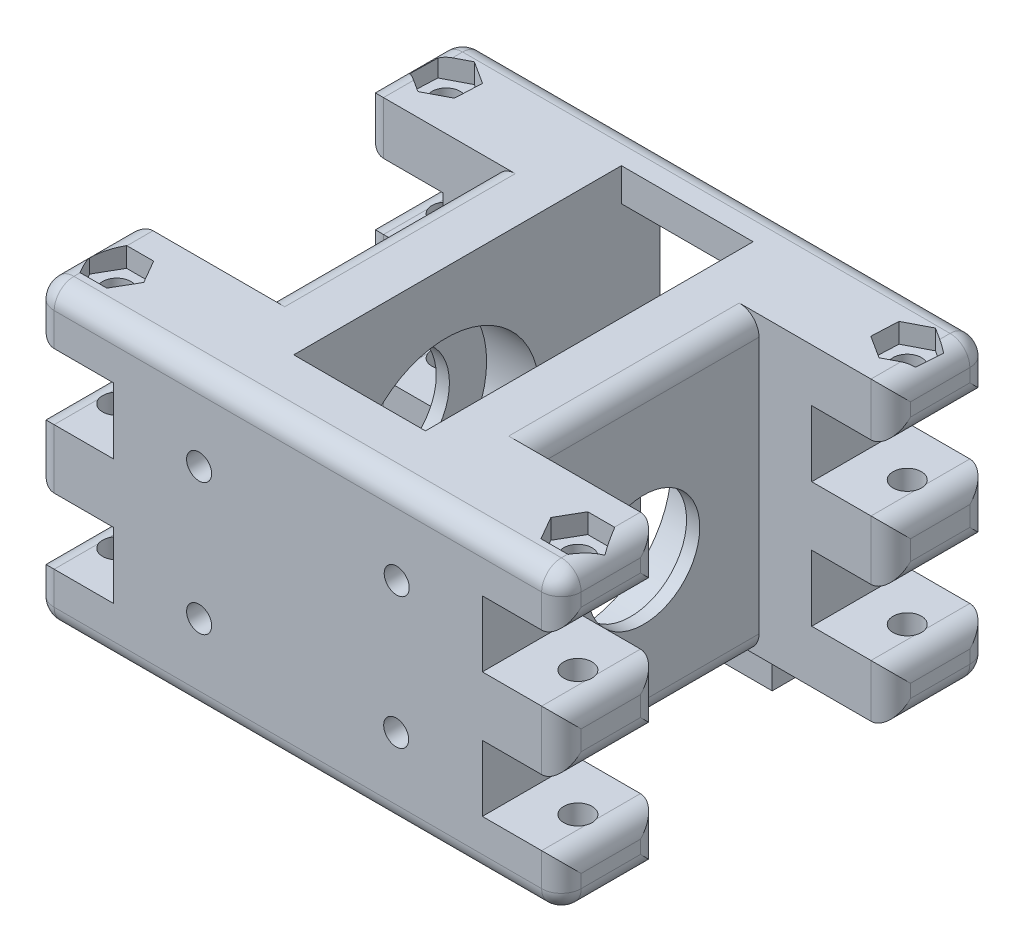
from build123d import *

# Parameters (mm, degrees)
MAIN_BODY_DEPTH            = 45
SKETCH3_W                  = 12
SKETCH3_H                  = 10
SUSPENSION_ARM_HOLE_DEPTH  = 92.869076093
SKETCH6_R                  = 8.5
AXLE_HOLE_DEPTH            = 91.851078857
SKETCH8_R                  = 2.15
SCREW_HOLE_DEPTH           = 83.727538774
SKETCH9_R                  = 4
SCREW_CLEARANCE_HOLE_DEPTH = 3
NUT_INSERT_HOLE_DEPTH      = 3
FILLET2_R                  = 3
FILLET4_R                  = 3
FILLET5_R                  = 3
SKETCH11_R                 = 1.9
MAIN_SCEW_HOLES_DEPTH      = 20
SKETCH5_W                  = 20
SKETCH5_H                  = 40
GEAR_SLOT_DEPTH            = 60
BEARING_HOLE_DEPTH         = 28
BEARING_HOLE_DEPTH_BACK    = 8
SKETCH12_R                 = 14.15
SKETCH13_W                 = 20
SKETCH13_H                 = 39.48022423
CUT_EXTRUDE1_DEPTH         = 81.117699038
SKETCH14_W                 = 20
SKETCH14_H                 = 30.450612157
CUT_EXTRUDE2_DEPTH         = 2
SKETCH15_W                 = 20
SKETCH15_H                 = 4.363509749
CUT_EXTRUDE3_DEPTH         = 10
SKETCH16_W                 = 20
SKETCH16_H                 = 5.896378136
CUT_EXTRUDE4_DEPTH         = 10
SKETCH17_W                 = 8
SKETCH17_H                 = 8
BOSS_EXTRUDE1_DEPTH        = 7.5
SKETCH18_R                 = 1.75
CUT_EXTRUDE5_DEPTH         = 7.5
SKETCH19_R                 = 1.45
CUT_EXTRUDE6_DEPTH         = 10
FILLET6_R                  = 5
FILLET7_R                  = 2


# Some blends are built 0.0001 mm under size
with BuildPart() as part:
    # Sketch2 → Main Body (new body)
    with BuildSketch(Plane(origin=(0, 0, 0), x_dir=(1, 0, 0), z_dir=(0, 1, 0))):
        Polygon((-46.796657382, 36.272980501), (-26.796657382, 36.272980501), (-26.796657382, 1.272980501), (-46.796657382, 1.272980501), (-46.796657382, -13.727019499), (33.203342618, -13.727019499), (33.203342618, 1.272980501), (13.203342618, 1.272980501), (13.203342618, 36.272980501), (33.203342618, 36.272980501), (33.203342618, 51.272980501), (-46.796657382, 51.272980501), align=None)
    extrude(amount=MAIN_BODY_DEPTH)

    # Sketch3 → Suspension Arm Hole (cut, through all)
    with BuildSketch(Plane(origin=(0, 0, -51.272980501), x_dir=(-1, 0, 0), z_dir=(0, 0, -1))):
        with Locations((-27.203342618, 32)):
            Rectangle(SKETCH3_W, SKETCH3_H)
        with Locations((-27.203342618, 13)):
            Rectangle(SKETCH3_W, SKETCH3_H)
        with Locations((40.796657382, 32)):
            Rectangle(SKETCH3_W, SKETCH3_H)
        with Locations((40.796657382, 13)):
            Rectangle(SKETCH3_W, SKETCH3_H)
    extrude(amount=-SUSPENSION_ARM_HOLE_DEPTH, mode=Mode.SUBTRACT)

    # Sketch6 → Axle Hole (cut, through all)
    with BuildSketch(Plane(origin=(13.203342618, 0, 0), x_dir=(0, 0, -1), z_dir=(1, 0, 0))):
        with Locations((18.772980501, 21.5)):
            Circle(SKETCH6_R)
    extrude(amount=-AXLE_HOLE_DEPTH, mode=Mode.SUBTRACT)

    # Sketch8 → Screw Hole (cut, through all)
    with BuildSketch(Plane.XZ):
        with Locations(Location((-41.796657382, 6.227019499, 0), (0, 0, 270))):
            Circle(SKETCH8_R)
        with Locations(Location((28.203342618, 6.227019499, 0), (0, 0, 270))):
            Circle(SKETCH8_R)
        with Locations(Location((-41.796657382, -43.772980501, 0), (0, 0, 270))):
            Circle(SKETCH8_R)
        with Locations(Location((28.203342618, -43.772980501, 0), (0, 0, 270))):
            Circle(SKETCH8_R)
    extrude(amount=-SCREW_HOLE_DEPTH, mode=Mode.SUBTRACT)

    # Sketch9 → Screw Clearance Hole (cut)
    with BuildSketch(Plane.XZ):
        with Locations(Location((-41.796657382, 6.227019499, 0), (0, 0, 270))):
            Circle(SKETCH9_R)
        with Locations(Location((28.203342618, 6.227019499, 0), (0, 0, 270))):
            Circle(SKETCH9_R)
        with Locations(Location((28.203342618, -43.772980501, 0), (0, 0, 270))):
            Circle(SKETCH9_R)
        with Locations(Location((-41.796657382, -43.772980501, 0), (0, 0, 270))):
            Circle(SKETCH9_R)
    extrude(amount=-SCREW_CLEARANCE_HOLE_DEPTH, mode=Mode.SUBTRACT)

    # Sketch10 → Nut Insert Hole (cut)
    with BuildSketch(Plane(origin=(0, 45, 0), x_dir=(1, 0, 0), z_dir=(0, 1, 0))):
        Polygon((28.387835771, 47.868827456), (24.748481682, 45.980679735), (24.563988529, 41.884832781), (28.018849466, 39.677133547), (31.658203555, 41.565281267), (31.842696707, 45.661128222), align=None)
        Polygon((-41.612164229, 47.868827456), (-45.251518318, 45.980679735), (-45.436011471, 41.884832781), (-41.981150534, 39.677133547), (-38.341796445, 41.565281267), (-38.157303293, 45.661128222), align=None)
        Polygon((-45.896657382, -6.227019499), (-43.846657382, -9.777723654), (-39.746657382, -9.777723654), (-37.696657382, -6.227019499), (-39.746657382, -2.676315343), (-43.846657382, -2.676315343), align=None)
        Polygon((24.103342618, -6.227019499), (26.153342618, -9.777723654), (30.253342618, -9.777723654), (32.303342618, -6.227019499), (30.253342618, -2.676315343), (26.153342618, -2.676315343), align=None)
    extrude(amount=-NUT_INSERT_HOLE_DEPTH, mode=Mode.SUBTRACT)

    # Fillet2
    # the kernel refuses this fillet: 3 mm, written as the material it takes off along each edge
    with BuildSketch(Plane(origin=(33.203342618, 45, 21.227019499), x_dir=(-1, 0, 0), z_dir=(0, 0, -1)), Plane(origin=(33.203342618, 27, -8.772980501), x_dir=(0, -1, 0), z_dir=(0, 0, 1)), Plane(origin=(33.203342618, 18, -8.772980501), x_dir=(-1, 0, 0), z_dir=(0, 0, 1)), Plane(origin=(33.203342618, 8, -8.772980501), x_dir=(0, -1, 0), z_dir=(0, 0, 1)), Plane(origin=(33.203342618, 8, -58.772980501), x_dir=(0, -1, 0), z_dir=(0, 0, 1)), Plane(origin=(33.203342618, 45, -28.772980501), x_dir=(-1, 0, 0), z_dir=(0, 0, -1)), Plane(origin=(-46.796657382, 45, -8.772980501), x_dir=(1, 0, 0), z_dir=(0, 0, 1)), Plane(origin=(-46.796657382, 37, -8.772980501), x_dir=(0, 1, 0), z_dir=(0, 0, 1)), Plane(origin=(-46.796657382, 45, -58.772980501), x_dir=(1, 0, 0), z_dir=(0, 0, 1)), Plane(origin=(-46.796657382, 37, -58.772980501), x_dir=(0, 1, 0), z_dir=(0, 0, 1)), Plane(origin=(-46.796657382, 18, -58.772980501), x_dir=(0, 1, 0), z_dir=(0, 0, 1)), Plane(origin=(-46.796657382, 27, -58.772980501), x_dir=(1, 0, 0), z_dir=(0, 0, 1)), Plane(origin=(-46.796657382, 8, -58.772980501), x_dir=(1, 0, 0), z_dir=(0, 0, 1))) as fillet2_piece_1:
        with BuildLine():
            CenterArc((FILLET2_R, -FILLET2_R), FILLET2_R, 90, 90)
            Line((0, -FILLET2_R), (0, 0))
            Line((0, 0), (FILLET2_R, 0))
        make_face()
    extrude(amount=30, mode=Mode.SUBTRACT)
    with BuildSketch(Plane(origin=(33.203342618, 29.5, -1.272980501), x_dir=(-1, 0, 0), z_dir=(0, 1, 0)), Plane(origin=(33.203342618, -7.5, -36.272980501), x_dir=(0, 0, -1), z_dir=(0, 1, 0)), Plane(origin=(33.203342618, -7.5, -51.272980501), x_dir=(-1, 0, 0), z_dir=(0, 1, 0)), Plane(origin=(33.203342618, 29.5, -51.272980501), x_dir=(-1, 0, 0), z_dir=(0, 1, 0)), Plane(origin=(-46.796657382, 29.5, 13.727019499), x_dir=(1, 0, 0), z_dir=(0, 1, 0)), Plane(origin=(-46.796657382, 29.5, -36.272980501), x_dir=(1, 0, 0), z_dir=(0, 1, 0)), Plane(origin=(-46.796657382, 29.5, -51.272980501), x_dir=(0, 0, 1), z_dir=(0, 1, 0)), Plane(origin=(-46.796657382, -7.5, -51.272980501), x_dir=(0, 0, 1), z_dir=(0, 1, 0)), Plane(origin=(-46.796657382, -7.5, -36.272980501), x_dir=(1, 0, 0), z_dir=(0, 1, 0))) as fillet2_piece_2:
        with BuildLine():
            CenterArc((FILLET2_R, FILLET2_R), FILLET2_R, 180, 90)
            Line((0, FILLET2_R), (0, 0))
            Line((0, 0), (FILLET2_R, 0))
        make_face()
    extrude(amount=23, mode=Mode.SUBTRACT)
    with BuildSketch(Plane(origin=(33.203342618, 37, -8.772980501), x_dir=(0, 1, 0), z_dir=(0, 0, 1)), Plane(origin=(33.203342618, 0, 21.227019499), x_dir=(-1, 0, 0), z_dir=(0, 0, -1)), Plane(origin=(33.203342618, 0, -28.772980501), x_dir=(-1, 0, 0), z_dir=(0, 0, -1)), Plane(origin=(33.203342618, 27, -58.772980501), x_dir=(-1, 0, 0), z_dir=(0, 0, 1)), Plane(origin=(33.203342618, 18, -58.772980501), x_dir=(0, 1, 0), z_dir=(0, 0, 1)), Plane(origin=(33.203342618, 37, -58.772980501), x_dir=(0, 1, 0), z_dir=(0, 0, 1)), Plane(origin=(-46.796657382, 18, -8.772980501), x_dir=(1, 0, 0), z_dir=(0, 0, 1)), Plane(origin=(-46.796657382, 27, -8.772980501), x_dir=(0, -1, 0), z_dir=(0, 0, 1)), Plane(origin=(-46.796657382, 0, -8.772980501), x_dir=(1, 0, 0), z_dir=(0, 0, 1)), Plane(origin=(-46.796657382, 8, -8.772980501), x_dir=(0, -1, 0), z_dir=(0, 0, 1)), Plane(origin=(-46.796657382, 0, -58.772980501), x_dir=(1, 0, 0), z_dir=(0, 0, 1))) as fillet2_piece_3:
        with BuildLine():
            CenterArc((FILLET2_R, FILLET2_R), FILLET2_R, 180, 90)
            Line((0, FILLET2_R), (0, 0))
            Line((0, 0), (FILLET2_R, 0))
        make_face()
    extrude(amount=30, mode=Mode.SUBTRACT)
    with BuildSketch(Plane(origin=(33.203342618, 29.5, 13.727019499), x_dir=(-1, 0, 0), z_dir=(0, 1, 0)), Plane(origin=(33.203342618, -7.5, 13.727019499), x_dir=(-1, 0, 0), z_dir=(0, 1, 0)), Plane(origin=(33.203342618, -7.5, -1.272980501), x_dir=(0, 0, 1), z_dir=(0, 1, 0)), Plane(origin=(33.203342618, 29.5, -36.272980501), x_dir=(-1, 0, 0), z_dir=(0, 1, 0)), Plane(origin=(-46.796657382, 29.5, -1.272980501), x_dir=(1, 0, 0), z_dir=(0, 1, 0)), Plane(origin=(-46.796657382, -7.5, -1.272980501), x_dir=(1, 0, 0), z_dir=(0, 1, 0)), Plane(origin=(-46.796657382, -7.5, 13.727019499), x_dir=(0, 0, -1), z_dir=(0, 1, 0))) as fillet2_piece_4:
        with BuildLine():
            CenterArc((FILLET2_R, -FILLET2_R), FILLET2_R, 90, 90)
            Line((0, -FILLET2_R), (0, 0))
            Line((0, 0), (FILLET2_R, 0))
        make_face()
    extrude(amount=23, mode=Mode.SUBTRACT)
    with BuildSketch(Plane(origin=(33.203342618, 10.5, -1.272980501), x_dir=(-1, 0, 0), z_dir=(0, 1, 0)), Plane(origin=(33.203342618, 10.5, -51.272980501), x_dir=(-1, 0, 0), z_dir=(0, 1, 0)), Plane(origin=(-46.796657382, 10.5, 13.727019499), x_dir=(1, 0, 0), z_dir=(0, 1, 0)), Plane(origin=(-46.796657382, 10.5, -51.272980501), x_dir=(0, 0, 1), z_dir=(0, 1, 0)), Plane(origin=(-46.796657382, 10.5, -36.272980501), x_dir=(1, 0, 0), z_dir=(0, 1, 0))) as fillet2_piece_5:
        with BuildLine():
            CenterArc((FILLET2_R, FILLET2_R), FILLET2_R, 180, 90)
            Line((0, FILLET2_R), (0, 0))
            Line((0, 0), (FILLET2_R, 0))
        make_face()
    extrude(amount=24, mode=Mode.SUBTRACT)
    with BuildSketch(Plane(origin=(33.203342618, 10.5, 13.727019499), x_dir=(-1, 0, 0), z_dir=(0, 1, 0)), Plane(origin=(33.203342618, 10.5, -36.272980501), x_dir=(-1, 0, 0), z_dir=(0, 1, 0)), Plane(origin=(-46.796657382, 10.5, -1.272980501), x_dir=(1, 0, 0), z_dir=(0, 1, 0))) as fillet2_piece_6:
        with BuildLine():
            CenterArc((FILLET2_R, -FILLET2_R), FILLET2_R, 90, 90)
            Line((0, -FILLET2_R), (0, 0))
            Line((0, 0), (FILLET2_R, 0))
        make_face()
    extrude(amount=24, mode=Mode.SUBTRACT)

    # Fillet4
    # the kernel refuses this fillet: 3 mm, written as the material it takes off along each edge
    with BuildSketch(Plane(origin=(30.203342618, 42, 10.727019499), x_dir=(0, 0, 1), z_dir=(0, 1, 0))) as fillet4_piece_1_section:
        Polygon((0, 0), (FILLET4_R, 0), (FILLET4_R, FILLET4_R), (0, FILLET4_R), align=None)
    fillet4_piece_1 = extrude(amount=FILLET4_R, mode=Mode.PRIVATE)
    fillet4_piece_1 = fillet4_piece_1 - Plane(origin=(30.203342618, 42, 10.727019499), x_dir=(-0.7071067811865477, 0, -0.7071067811865475), z_dir=(0, 1, 0)) * Sphere(FILLET4_R, mode=Mode.PRIVATE)
    add(fillet4_piece_1, mode=Mode.SUBTRACT)
    with BuildSketch(Plane(origin=(30.203342618, 42, -48.272980501), x_dir=(0, 0, -1), z_dir=(0, 1, 0))) as fillet4_piece_2_section:
        Polygon((0, 0), (FILLET4_R, 0), (FILLET4_R, -FILLET4_R), (0, -FILLET4_R), align=None)
    fillet4_piece_2 = extrude(amount=FILLET4_R, mode=Mode.PRIVATE)
    fillet4_piece_2 = fillet4_piece_2 - Plane(origin=(30.203342618, 42, -48.272980501), x_dir=(-0.7071067811865475, 0, 0.7071067811865476), z_dir=(0, 1, 0)) * Sphere(FILLET4_R, mode=Mode.PRIVATE)
    add(fillet4_piece_2, mode=Mode.SUBTRACT)
    with BuildSketch(Plane(origin=(-43.796657382, 42, 10.727019499), x_dir=(0, 0, 1), z_dir=(0, 1, 0))) as fillet4_piece_3_section:
        Polygon((0, 0), (FILLET4_R, 0), (FILLET4_R, -FILLET4_R), (0, -FILLET4_R), align=None)
    fillet4_piece_3 = extrude(amount=FILLET4_R, mode=Mode.PRIVATE)
    fillet4_piece_3 = fillet4_piece_3 - Plane(origin=(-43.796657382, 42, 10.727019499), x_dir=(0.7071067811865475, 0, -0.7071067811865476), z_dir=(0, 1, 0)) * Sphere(FILLET4_R, mode=Mode.PRIVATE)
    add(fillet4_piece_3, mode=Mode.SUBTRACT)
    with BuildSketch(Plane(origin=(-43.796657382, 42, -48.272980501), x_dir=(0, 0, -1), z_dir=(0, 1, 0))) as fillet4_piece_4_section:
        Polygon((0, 0), (FILLET4_R, 0), (FILLET4_R, FILLET4_R), (0, FILLET4_R), align=None)
    fillet4_piece_4 = extrude(amount=FILLET4_R, mode=Mode.PRIVATE)
    fillet4_piece_4 = fillet4_piece_4 - Plane(origin=(-43.796657382, 42, -48.272980501), x_dir=(0.7071067811865477, 0, 0.7071067811865475), z_dir=(0, 1, 0)) * Sphere(FILLET4_R, mode=Mode.PRIVATE)
    add(fillet4_piece_4, mode=Mode.SUBTRACT)
    with BuildSketch(Plane(origin=(13.203342618, 45, -1.272980501), x_dir=(-1, 0, 0), z_dir=(0, 0, -1))) as fillet4_piece_5:
        with BuildLine():
            CenterArc((FILLET4_R, -FILLET4_R), FILLET4_R, 90, 90)
            Line((0, -FILLET4_R), (0, 0))
            Line((0, 0), (FILLET4_R, 0))
        make_face()
    extrude(amount=35, mode=Mode.SUBTRACT)
    with BuildSketch(Plane(origin=(30.203342618, 45, -51.272980501), x_dir=(0, 0, 1), z_dir=(-1, 0, 0)), Plane(origin=(-43.796657382, 45, 13.727019499), x_dir=(0, 0, -1), z_dir=(1, 0, 0))) as fillet4_piece_6:
        with BuildLine():
            CenterArc((FILLET4_R, -FILLET4_R), FILLET4_R, 90, 90)
            Line((0, -FILLET4_R), (0, 0))
            Line((0, 0), (FILLET4_R, 0))
        make_face()
    extrude(amount=74, mode=Mode.SUBTRACT)
    with BuildSketch(Plane(origin=(-26.796657382, 45, -36.272980501), x_dir=(0, -1, 0), z_dir=(0, 0, 1))) as fillet4_piece_7:
        with BuildLine():
            CenterArc((FILLET4_R, FILLET4_R), FILLET4_R, 180, 90)
            Line((0, FILLET4_R), (0, 0))
            Line((0, 0), (FILLET4_R, 0))
        make_face()
    extrude(amount=35, mode=Mode.SUBTRACT)

    # Fillet5
    # the kernel refuses this fillet: 3 mm, written as the material it takes off along each edge
    with BuildSketch(Plane(origin=(30.203342618, 3, 10.727019499), x_dir=(0, -1, 0), z_dir=(0, 0, 1))) as fillet5_piece_1_section:
        Polygon((0, 0), (FILLET5_R, 0), (FILLET5_R, FILLET5_R), (0, FILLET5_R), align=None)
    fillet5_piece_1 = extrude(amount=FILLET5_R, mode=Mode.PRIVATE)
    fillet5_piece_1 = fillet5_piece_1 - Plane(origin=(30.203342618, 3, 10.727019499), x_dir=(-0.7071067811865475, 0.7071067811865475, 0), z_dir=(0, 0, 1)) * Sphere(FILLET5_R, mode=Mode.PRIVATE)
    add(fillet5_piece_1, mode=Mode.SUBTRACT)
    with BuildSketch(Plane(origin=(30.203342618, 3, -48.272980501), x_dir=(0, -1, 0), z_dir=(0, 0, -1))) as fillet5_piece_2_section:
        Polygon((0, 0), (FILLET5_R, 0), (FILLET5_R, -FILLET5_R), (0, -FILLET5_R), align=None)
    fillet5_piece_2 = extrude(amount=FILLET5_R, mode=Mode.PRIVATE)
    fillet5_piece_2 = fillet5_piece_2 - Plane(origin=(30.203342618, 3, -48.272980501), x_dir=(-0.7071067811865475, 0.7071067811865475, 0), z_dir=(0, 0, -1)) * Sphere(FILLET5_R, mode=Mode.PRIVATE)
    add(fillet5_piece_2, mode=Mode.SUBTRACT)
    with BuildSketch(Plane(origin=(-43.796657382, 3, 10.727019499), x_dir=(0, -1, 0), z_dir=(0, 0, 1))) as fillet5_piece_3_section:
        Polygon((0, 0), (FILLET5_R, 0), (FILLET5_R, -FILLET5_R), (0, -FILLET5_R), align=None)
    fillet5_piece_3 = extrude(amount=FILLET5_R, mode=Mode.PRIVATE)
    fillet5_piece_3 = fillet5_piece_3 - Plane(origin=(-43.796657382, 3, 10.727019499), x_dir=(0.7071067811865475, 0.7071067811865475, 0), z_dir=(0, 0, 1)) * Sphere(FILLET5_R, mode=Mode.PRIVATE)
    add(fillet5_piece_3, mode=Mode.SUBTRACT)
    with BuildSketch(Plane(origin=(-43.796657382, 3, -48.272980501), x_dir=(0, -1, 0), z_dir=(0, 0, -1))) as fillet5_piece_4_section:
        Polygon((0, 0), (FILLET5_R, 0), (FILLET5_R, FILLET5_R), (0, FILLET5_R), align=None)
    fillet5_piece_4 = extrude(amount=FILLET5_R, mode=Mode.PRIVATE)
    fillet5_piece_4 = fillet5_piece_4 - Plane(origin=(-43.796657382, 3, -48.272980501), x_dir=(0.7071067811865475, 0.7071067811865475, 0), z_dir=(0, 0, -1)) * Sphere(FILLET5_R, mode=Mode.PRIVATE)
    add(fillet5_piece_4, mode=Mode.SUBTRACT)
    with BuildSketch(Plane(origin=(-26.796657382, 0, -36.272980501), x_dir=(0, 1, 0), z_dir=(0, 0, 1)), Plane(origin=(13.203342618, 0, -1.272980501), x_dir=(0, 1, 0), z_dir=(0, 0, -1))) as fillet5_piece_5:
        with BuildLine():
            CenterArc((FILLET5_R, -FILLET5_R), FILLET5_R, 90, 90)
            Line((0, -FILLET5_R), (0, 0))
            Line((0, 0), (FILLET5_R, 0))
        make_face()
    extrude(amount=35, mode=Mode.SUBTRACT)
    with BuildSketch(Plane(origin=(-43.796657382, 0, 13.727019499), x_dir=(0, 1, 0), z_dir=(1, 0, 0)), Plane(origin=(30.203342618, 0, -51.272980501), x_dir=(0, 1, 0), z_dir=(-1, 0, 0))) as fillet5_piece_6:
        with BuildLine():
            CenterArc((FILLET5_R, -FILLET5_R), FILLET5_R, 90, 90)
            Line((0, -FILLET5_R), (0, 0))
            Line((0, 0), (FILLET5_R, 0))
        make_face()
    extrude(amount=74, mode=Mode.SUBTRACT)

    # Sketch11 → Main Scew Holes (cut)
    with BuildSketch(Plane.XY.offset(13.727019499)):
        with Locations((-21.796657382, 32.5)):
            Circle(SKETCH11_R)
        with Locations((8.203342618, 32.5)):
            Circle(SKETCH11_R)
        with Locations((-21.796657382, 12.5)):
            Circle(SKETCH11_R)
        with Locations((8.123310636, 12.5)):
            Circle(SKETCH11_R)
    extrude(amount=-MAIN_SCEW_HOLES_DEPTH, mode=Mode.SUBTRACT)

    # Sketch5 → Gear Slot (cut)
    with BuildSketch(Plane(origin=(0, 0, -51.272980501), x_dir=(-1, 0, 0), z_dir=(0, 0, -1))):
        with Locations((6.796657382, 20)):
            Rectangle(SKETCH5_W, SKETCH5_H)
    extrude(amount=-GEAR_SLOT_DEPTH, mode=Mode.SUBTRACT)

    # Sketch12 → Bearing Hole (cut, two sides: drawn at the far end of the back side and taken through both)
    with BuildSketch(Plane(origin=(-16.796657382, 0, 0), x_dir=(0, 0, -1), z_dir=(1, 0, 0)).offset(-BEARING_HOLE_DEPTH_BACK)):
        with Locations(Location((18.772980501, 21.5, 0), (0, 0, 270))):
            Circle(SKETCH12_R)
    extrude(amount=BEARING_HOLE_DEPTH + BEARING_HOLE_DEPTH_BACK, mode=Mode.SUBTRACT)

    # Sketch13 → Cut-Extrude1 (cut, through all)
    with BuildSketch(Plane.XZ.offset(-40)):
        with Locations((-6.796657382, -19.740112115)):
            Rectangle(SKETCH13_W, SKETCH13_H)
    extrude(amount=-CUT_EXTRUDE1_DEPTH, mode=Mode.SUBTRACT)

    # Sketch14 → Cut-Extrude2 (cut)
    with BuildSketch(Plane(origin=(0, 0, 8.727019499), x_dir=(-1, 0, 0), z_dir=(0, 0, -1))):
        with Locations((6.796657382, 19.272897082)):
            Rectangle(SKETCH14_W, SKETCH14_H)
    extrude(amount=-CUT_EXTRUDE2_DEPTH, mode=Mode.SUBTRACT)

    # Sketch15 → Cut-Extrude3 (cut)
    with BuildSketch(Plane.XZ.offset(-40)):
        with Locations((-6.796657382, 2.181754875)):
            Rectangle(SKETCH15_W, SKETCH15_H)
    extrude(amount=-CUT_EXTRUDE3_DEPTH, mode=Mode.SUBTRACT)

    # Sketch16 → Cut-Extrude4 (cut)
    with BuildSketch(Plane.XZ.offset(-40)):
        with Locations((-6.796657382, -42.428413298)):
            Rectangle(SKETCH16_W, SKETCH16_H)
    extrude(amount=-CUT_EXTRUDE4_DEPTH, mode=Mode.SUBTRACT)

    # Sketch17 → Boss-Extrude1 (add)
    with BuildSketch(Plane.XZ):
        with Locations((-20.796657382, -44.272980501)):
            Rectangle(SKETCH17_W, SKETCH17_H)
        with Locations((7.203342618, -44.272980501)):
            Rectangle(SKETCH17_W, SKETCH17_H)
    extrude(amount=BOSS_EXTRUDE1_DEPTH)

    # Sketch18 → Cut-Extrude5 (cut)
    with BuildSketch(Plane.XZ.offset(7.5)):
        with Locations(Location((-20.796657382, -44.472980501, 0), (0, 0, 270))):
            Circle(SKETCH18_R)
        with Locations(Location((7.203342618, -44.472980501, 0), (0, 0, 270))):
            Circle(SKETCH18_R)
    extrude(amount=-CUT_EXTRUDE5_DEPTH, mode=Mode.SUBTRACT)

    # Sketch19 → Cut-Extrude6 (cut)
    with BuildSketch(Plane(origin=(0, 0, -51.272980501), x_dir=(-1, 0, 0), z_dir=(0, 0, -1))):
        with Locations((-9.203342618, 35)):
            Circle(SKETCH19_R)
        with Locations((22.796657382, 35)):
            Circle(SKETCH19_R)
        with Locations((-9.203342618, 10)):
            Circle(SKETCH19_R)
        with Locations((22.796657382, 10)):
            Circle(SKETCH19_R)
    extrude(amount=-CUT_EXTRUDE6_DEPTH, mode=Mode.SUBTRACT)

    # Fillet6
    # the kernel refuses this fillet: 5 mm, written as the material it takes off along each edge
    with BuildSketch(Plane(origin=(3.203342618, 0, -40.272980501), x_dir=(1, 0, 0), z_dir=(0, 0, 1))) as fillet6_piece_1:
        with BuildLine():
            CenterArc((FILLET6_R, FILLET6_R), FILLET6_R, 180, 90)
            Line((0, FILLET6_R), (0, 0))
            Line((0, 0), (FILLET6_R, 0))
        make_face()
    extrude(amount=49, mode=Mode.SUBTRACT)
    with BuildSketch(Plane(origin=(3.203342618, 0, -40.272980501), x_dir=(1, 0, 0), z_dir=(0, 0, 1))) as fillet6_piece_2_section:
        with BuildLine():
            CenterArc((FILLET6_R, FILLET6_R), FILLET6_R, 180, 90)
            Line((0, FILLET6_R), (0, 0))
            Line((0, 0), (FILLET6_R, 0))
        make_face()
    fillet6_piece_2 = extrude(amount=61.5, mode=Mode.PRIVATE)
    fillet6_piece_2 = split(fillet6_piece_2, bisect_by=Plane(origin=(3.230762882, 4.285255133, 10.727019499), z_dir=(0, 0, -1)), keep=Keep.TOP, mode=Mode.PRIVATE)
    fillet6_piece_2 = split(fillet6_piece_2, bisect_by=Plane(origin=(3.230762882, 4.047591003, 9.727019499), z_dir=(0, 1, 0)), keep=Keep.TOP, mode=Mode.PRIVATE)
    add(fillet6_piece_2, mode=Mode.SUBTRACT)
    with BuildSketch(Plane(origin=(-16.796657382, 0, -40.272980501), x_dir=(-1, 0, 0), z_dir=(0, 0, 1))) as fillet6_piece_3:
        with BuildLine():
            CenterArc((FILLET6_R, -FILLET6_R), FILLET6_R, 90, 90)
            Line((0, -FILLET6_R), (0, 0))
            Line((0, 0), (FILLET6_R, 0))
        make_face()
    extrude(amount=49, mode=Mode.SUBTRACT)
    with BuildSketch(Plane(origin=(-16.796657382, 0, -52.772980501), x_dir=(-1, 0, 0), z_dir=(0, 0, 1))) as fillet6_piece_4_section:
        with BuildLine():
            CenterArc((FILLET6_R, -FILLET6_R), FILLET6_R, 90, 90)
            Line((0, -FILLET6_R), (0, 0))
            Line((0, 0), (FILLET6_R, 0))
        make_face()
    fillet6_piece_4 = extrude(amount=74, mode=Mode.PRIVATE)
    fillet6_piece_4 = split(fillet6_piece_4, bisect_by=Plane(origin=(-16.824077645, 4.285255133, 8.727019499), z_dir=(0, 0, 1)), keep=Keep.TOP, mode=Mode.PRIVATE)
    fillet6_piece_4 = split(fillet6_piece_4, bisect_by=Plane(origin=(-16.824077645, 4.285255133, 10.727019499), z_dir=(0, 0, -1)), keep=Keep.TOP, mode=Mode.PRIVATE)
    fillet6_piece_4 = split(fillet6_piece_4, bisect_by=Plane(origin=(-16.824077645, 4.047591003, 9.727019499), z_dir=(0, 1, 0)), keep=Keep.TOP, mode=Mode.PRIVATE)
    add(fillet6_piece_4, mode=Mode.SUBTRACT)

    # Fillet7
    fillet7_edges = [part.edges().sort_by_distance(p)[0] for p in [
        (-6.796657382, 34.49820316, 8.727019499),
        (-6.796657382, 40, 8.727019499),
        (-6.796657382, 40, 4.363509749),
    ]]
    fillet(fillet7_edges, radius=FILLET7_R - 0.0001)  # a hair under: the kernel refuses the full size


solid = part.part
